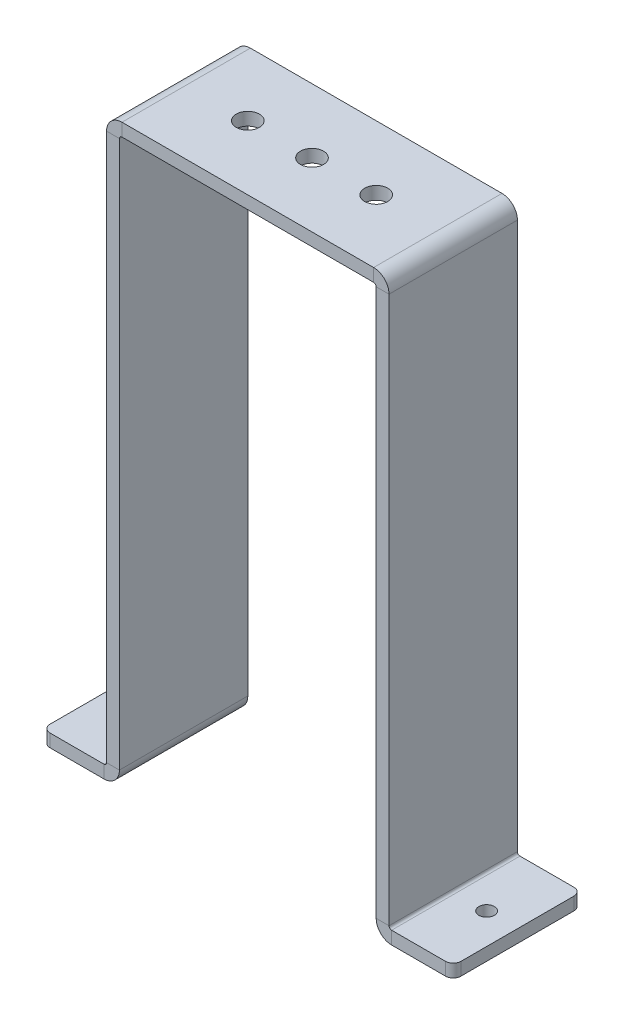
from build123d import *

# Parameters (mm, degrees)
BASE_FLANGE1_DEPTH = 25
CUT_EXTRUDE1_REACH = 237.425
SKETCH7_R          = 3
CUT_EXTRUDE2_REACH = 242.104
SKETCH8_R          = 4.5
FILLET1_R          = 3


# Sheet-metal steps are written as plain solids
with BuildPart() as part:
    # Sketch1 → Base-Flange1 (new, symmetric)
    with BuildSketch(Plane.XY):
        with BuildLine():
            Line((-80, 0), (-56, 0))
            ThreePointArc((-56, 0), (-51.757359313, 1.757359313), (-50, 6))
            Line((-50, 6), (-50, 219))
            ThreePointArc((-50, 219), (-49.707106781, 219.707106781), (-49, 220))
            Line((-49, 220), (49, 220))
            ThreePointArc((49, 220), (49.707106781, 219.707106781), (50, 219))
            Line((50, 219), (50, 6))
            ThreePointArc((50, 6), (51.757359313, 1.757359313), (56, 0))
            Line((56, 0), (80, 0))
            Line((80, 0), (80, 5))
            Line((80, 5), (56, 5))
            ThreePointArc((56, 5), (55.292893219, 5.292893219), (55, 6))
            Line((55, 6), (55, 219))
            ThreePointArc((55, 219), (53.242640687, 223.242640687), (49, 225))
            Line((49, 225), (-49, 225))
            ThreePointArc((-49, 225), (-53.242640687, 223.242640687), (-55, 219))
            Line((-55, 219), (-55, 6))
            ThreePointArc((-55, 6), (-55.292893219, 5.292893219), (-56, 5))
            Line((-56, 5), (-80, 5))
            Line((-80, 5), (-80, 0))
        make_face()
    extrude(amount=BASE_FLANGE1_DEPTH, both=True)

    # Sketch7 → Cut-Extrude1 (cut, up to next)
    with BuildSketch(Plane(origin=(0, 5, 0), x_dir=(1, 0, 0), z_dir=(0, 1, 0)), mode=Mode.PRIVATE) as cut_extrude1_sk1:
        with Locations(Location((68, 0, 0), (0, 0, 180))):
            Circle(SKETCH7_R)
    cut_extrude1_tool1 = extrude(cut_extrude1_sk1.sketch, amount=-CUT_EXTRUDE1_REACH, mode=Mode.PRIVATE) & part.part
    # Sketch7 → Cut-Extrude1 (cut, up to next)
    with BuildSketch(Plane(origin=(0, 5, 0), x_dir=(1, 0, 0), z_dir=(0, 1, 0)), mode=Mode.PRIVATE) as cut_extrude1_sk2:
        with Locations(Location((-68, 0, 0), (0, 0, 180))):
            Circle(SKETCH7_R)
    cut_extrude1_tool2 = extrude(cut_extrude1_sk2.sketch, amount=-CUT_EXTRUDE1_REACH, mode=Mode.PRIVATE) & part.part
    add(cut_extrude1_tool1.solids().sort_by_distance((68, 5, 0))[0], mode=Mode.SUBTRACT)
    add(cut_extrude1_tool2.solids().sort_by_distance((-68, 5, 0))[0], mode=Mode.SUBTRACT)

    # Sketch8 → Cut-Extrude2 (cut, up to next)
    with BuildSketch(Plane(origin=(0, 225, 0), x_dir=(1, 0, 0), z_dir=(0, 1, 0)), mode=Mode.PRIVATE) as cut_extrude2_sk1:
        with Locations(Location((0, 0, 0), (0, 0, 270))):
            Circle(SKETCH8_R)
    cut_extrude2_tool1 = extrude(cut_extrude2_sk1.sketch, amount=-CUT_EXTRUDE2_REACH, mode=Mode.PRIVATE) & part.part
    # Sketch8 → Cut-Extrude2 (cut, up to next)
    with BuildSketch(Plane(origin=(0, 225, 0), x_dir=(1, 0, 0), z_dir=(0, 1, 0)), mode=Mode.PRIVATE) as cut_extrude2_sk2:
        with Locations(Location((-25, 0, 0), (0, 0, 270))):
            Circle(SKETCH8_R)
    cut_extrude2_tool2 = extrude(cut_extrude2_sk2.sketch, amount=-CUT_EXTRUDE2_REACH, mode=Mode.PRIVATE) & part.part
    # Sketch8 → Cut-Extrude2 (cut, up to next)
    with BuildSketch(Plane(origin=(0, 225, 0), x_dir=(1, 0, 0), z_dir=(0, 1, 0)), mode=Mode.PRIVATE) as cut_extrude2_sk3:
        with Locations(Location((25, 0, 0), (0, 0, 270))):
            Circle(SKETCH8_R)
    cut_extrude2_tool3 = extrude(cut_extrude2_sk3.sketch, amount=-CUT_EXTRUDE2_REACH, mode=Mode.PRIVATE) & part.part
    add(cut_extrude2_tool1.solids().sort_by_distance((0, 225, 0))[0], mode=Mode.SUBTRACT)
    add(cut_extrude2_tool2.solids().sort_by_distance((-25, 225, 0))[0], mode=Mode.SUBTRACT)
    add(cut_extrude2_tool3.solids().sort_by_distance((25, 225, 0))[0], mode=Mode.SUBTRACT)

    # Fillet1
    fillet1_edges = [part.edges().sort_by_distance(p)[0] for p in [
        (80, 2.5, -25),
        (-80, 2.5, -25),
        (80, 2.5, 25),
        (-80, 2.5, 25),
    ]]
    fillet(fillet1_edges, radius=FILLET1_R)


solid = part.part
